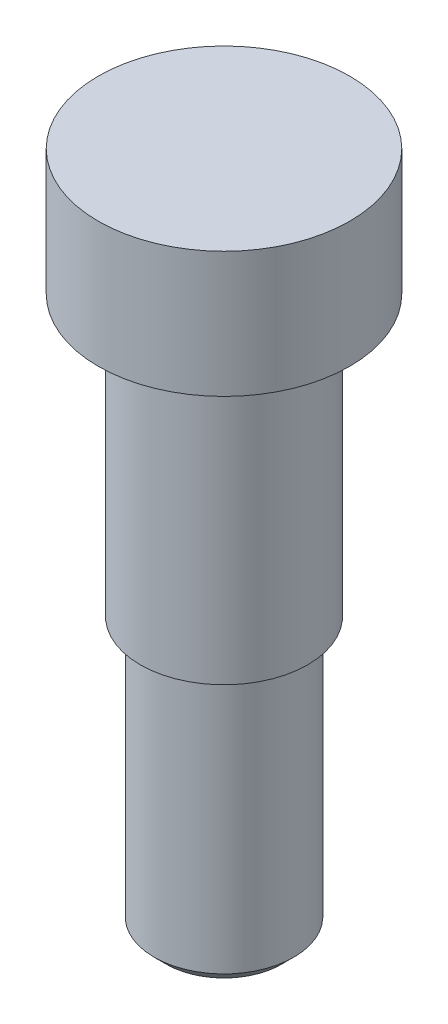
from build123d import *


# Read off the part's stored shape, not the designer's step: M5 机械螺纹 螺柱1
with BuildPart() as part:
    # 草图1 → 旋转1 (revolve)
    with BuildSketch(Plane.XY, mode=Mode.PRIVATE) as revolve_1_sk:
        Polygon((0, 0), (0, 24.25), (4.5, 24.25), (4.5, 19.75), (3, 19.75), (3, 9.75), (2.8, 9.75), (2.8, 0), align=None)
    revolve(revolve_1_sk.sketch.rotate(Axis((0, 0, 0), (0, 1, 0)), 90), axis=Axis((0, 0, 0), (0, 1, 0)))

    # M5 机械螺纹 螺柱1 outline → M5 机械螺纹 螺柱1 (revolve, cut)
    with BuildSketch(Plane.XY):
        Polygon((2.8, 9.75), (2.5, 9.75), (2.5, 0.433), (2.067, 0), (2.8, 0), align=None)
    revolve(axis=Axis((0, 0, 0), (0, 1, 0)), mode=Mode.SUBTRACT)


solid = part.part
